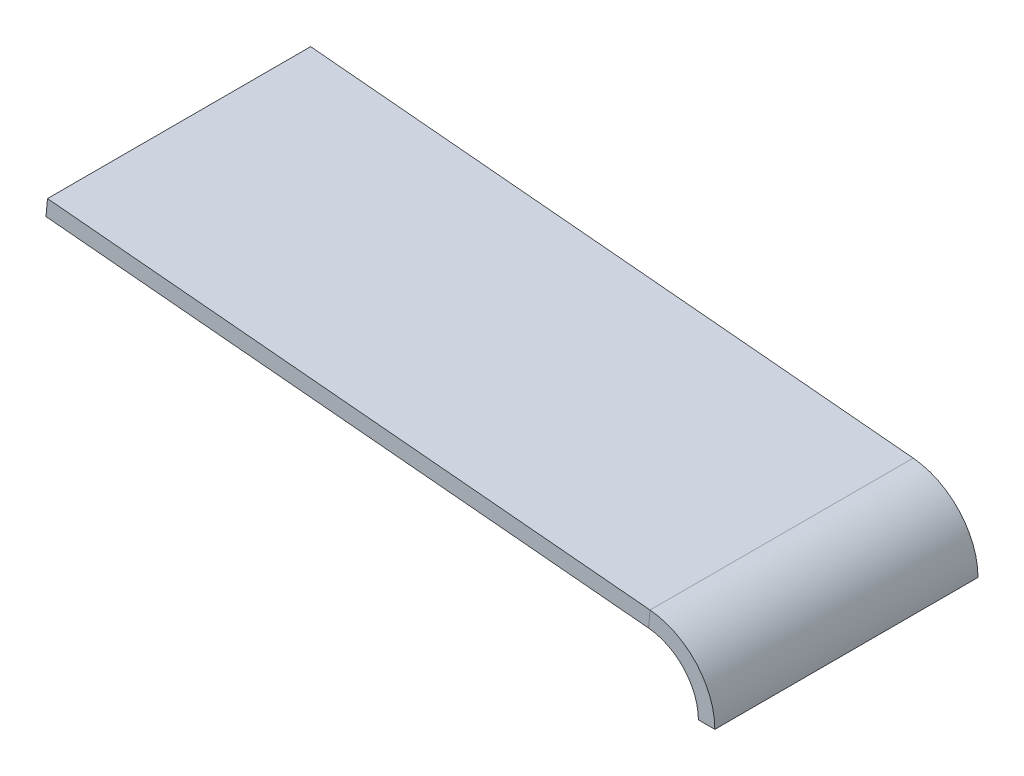
from build123d import *

# Parameters (mm, degrees)
BASE_FLANGE1_DEPTH      = 2.4
BASE_FLANGE1_DEPTH_BACK = 2.4


# Sheet-metal steps are written as plain solids
with BuildPart() as part:
    # Sketch2 → Base-Flange1 (new, two sides: drawn at the far end of the back side and taken through both)
    with BuildSketch(Plane.XY.offset(-2.9).offset(-BASE_FLANGE1_DEPTH_BACK)):
        with BuildLine():
            Line((-7.675, 3.9), (3.315435248, 2.895852113))
            ThreePointArc((3.315435248, 2.895852113), (3.963023803, 2.574171105), (4.224448606, 1.9))
            Line((4.224448606, 1.9), (4.524448606, 1.9))
            ThreePointArc((4.524448606, 1.9), (4.184596362, 2.776422437), (3.342731241, 3.194607747))
            Line((3.342731241, 3.194607747), (-7.647704007, 4.198755634))
            Line((-7.647704007, 4.198755634), (-7.675, 3.9))
        make_face()
    extrude(amount=BASE_FLANGE1_DEPTH + BASE_FLANGE1_DEPTH_BACK)


solid = part.part
